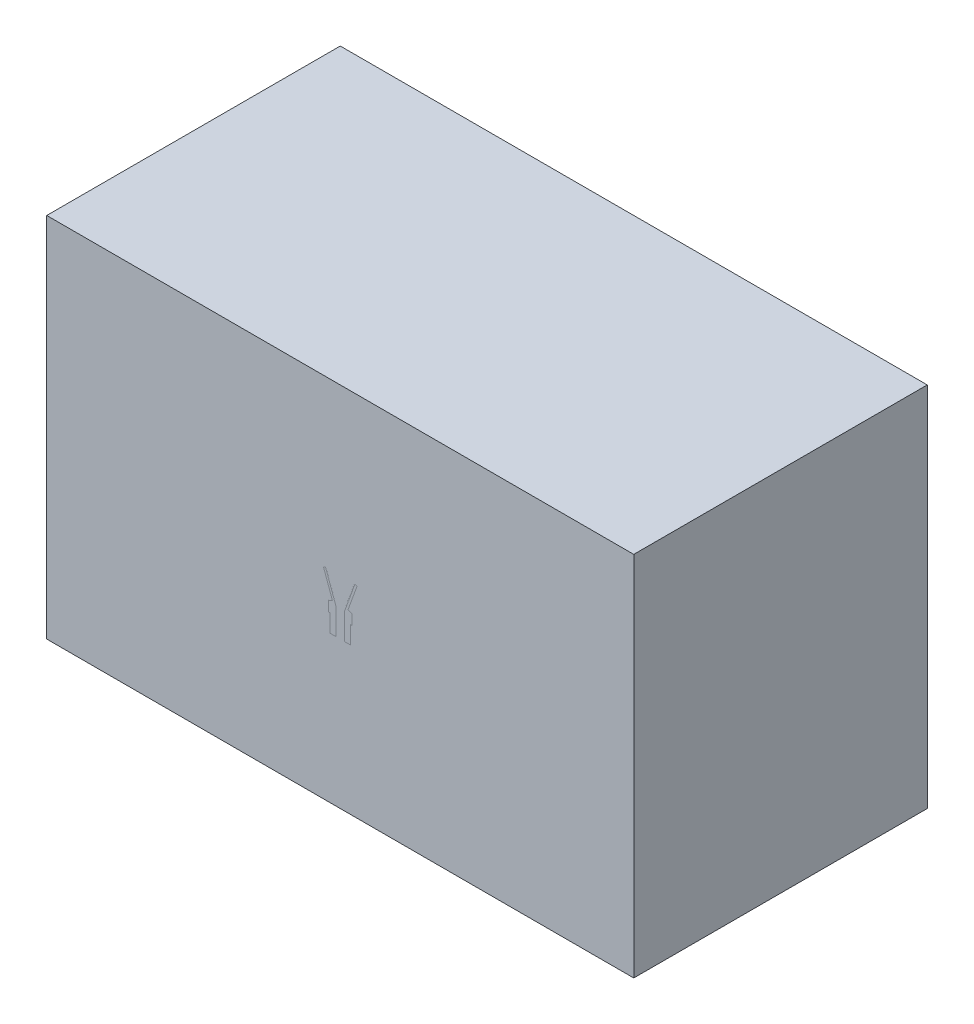
from build123d import *

# Parameters (mm, degrees)
SKETCH1_R           = 175
SKETCH1_R_2         = 75
BOSS_EXTRUDE1_DEPTH = 457
SKETCH3_W           = 10160
SKETCH3_H           = 6350
BOSS_EXTRUDE2_DEPTH = 5080
SKETCH4_W           = 13475.768327993
SKETCH4_H           = 8367.586519284
CUT_EXTRUDE1_DEPTH  = 8132.96778154


# Read off the part's stored shape, not the designer's step: Intersect1
with BuildPart() as part:
    # Sketch1 → Boss-Extrude1 (new body)
    with BuildSketch(Plane(origin=(0, 0, 0), x_dir=(1, 0, 0), z_dir=(0, 1, 0))):
        with Locations(Location((0, 0, 0), (0, 0, 270))):
            Circle(SKETCH1_R)
        with Locations(Location((0, 0, 0), (0, 0, 270))):
            Circle(SKETCH1_R_2, mode=Mode.SUBTRACT)
    extrude(amount=BOSS_EXTRUDE1_DEPTH)

    # Sketch2 → Revolve1 (revolve)
    with BuildSketch(Plane.XY, mode=Mode.PRIVATE) as revolve1_sk:
        Polygon((-175, 307), (-200.4, 307), (-200.4, 482.4), (-139.277313963, 504.646838356), (-135.674750747, 511.361444694), (-290.297671627, 936.184428342), (-254.495382775, 949.215395803), (-250.151726955, 937.281299519), (-239.483726955, 941.164133978), (-237.746264627, 936.390495464), (-248.414264627, 932.507661005), (-234.546998701, 894.407661005), (-223.878998701, 898.290495464), (-222.141536373, 893.516856951), (-232.809536373, 889.634022491), (-218.942270448, 851.534022491), (-208.274270448, 855.416856951), (-206.53680812, 850.643218437), (-217.20480812, 846.760383978), (-203.337542194, 808.660383978), (-192.669542194, 812.543218437), (-190.932079866, 807.769579923), (-201.600079866, 803.886745464), (-187.732813941, 765.786745464), (-177.064813941, 769.669579923), (-175.327351612, 764.89594141), (-185.995351612, 761.013106951), (-172.128085687, 722.913106951), (-161.460085687, 726.79594141), (-159.722623359, 722.022302896), (-170.390623359, 718.139468437), (-156.523357433, 680.039468437), (-145.855357433, 683.922302896), (-144.117895105, 679.148664383), (-154.785895105, 675.265829923), (-140.91862918, 637.165829923), (-130.25062918, 641.048664383), (-128.513166852, 636.275025869), (-139.181166852, 632.39219141), (-125.313900926, 594.29219141), (-114.645900926, 598.175025869), (-112.908438598, 593.401387355), (-123.576438598, 589.518552896), (-109.709172672, 551.418552896), (-99.041172672, 555.301387355), (-97.303710344, 550.527748842), (-107.668277546, 546.755354889), (-101.061934921, 528.604577704), (-75, 457), (-175, 457), align=None)
    revolve(revolve1_sk.sketch.rotate(Axis((0, 0, 0), (0, 1, 0)), 270), axis=Axis((0, 0, 0), (0, 1, 0)))


with BuildPart() as body_2:
    # Sketch3 → Boss-Extrude2 (new, symmetric)
    with BuildSketch(Plane(origin=(0, 0, 0), x_dir=(0, 0, -1), z_dir=(1, 0, 0))):
        with Locations((0, 635)):
            Rectangle(SKETCH3_W, SKETCH3_H)
    extrude(amount=BOSS_EXTRUDE2_DEPTH, both=True)

    # Intersect1 outline → Intersect1 (revolve, cut)
    with BuildSketch(Plane.XY):
        Polygon((107.668277546, 546.755354889), (75, 457), (75, 0), (175, 0), (175, 307), (200.4, 307), (200.4, 482.4), (139.277313963, 504.646838356), (135.674750747, 511.361444694), (290.297671627, 936.184428342), (254.495382775, 949.215395803), (250.151726955, 937.281299519), (239.483726955, 941.164133978), (237.746264627, 936.390495464), (248.414264627, 932.507661005), (234.546998701, 894.407661005), (223.878998701, 898.290495464), (222.141536373, 893.516856951), (232.809536373, 889.634022491), (218.942270448, 851.534022491), (208.274270448, 855.416856951), (206.53680812, 850.643218437), (217.20480812, 846.760383978), (203.337542194, 808.660383978), (192.669542194, 812.543218437), (190.932079866, 807.769579923), (201.600079866, 803.886745464), (187.732813941, 765.786745464), (177.064813941, 769.669579923), (175.327351612, 764.89594141), (185.995351612, 761.013106951), (172.128085687, 722.913106951), (161.460085687, 726.79594141), (159.722623359, 722.022302896), (170.390623359, 718.139468437), (156.523357433, 680.039468437), (145.855357433, 683.922302896), (144.117895105, 679.148664383), (154.785895105, 675.265829923), (140.91862918, 637.165829923), (130.25062918, 641.048664383), (128.513166852, 636.275025869), (139.181166852, 632.39219141), (125.313900926, 594.29219141), (114.645900926, 598.175025869), (112.908438598, 593.401387355), (123.576438598, 589.518552896), (109.709172672, 551.418552896), (99.041172672, 555.301387355), (97.303710344, 550.527748842), align=None)
    revolve(axis=Axis((0, 0, 0), (0, 1, 0)), mode=Mode.SUBTRACT)


with BuildPart() as cut_extrude1_tool:
    # Sketch4 → Cut-Extrude1 (new, through all)
    with BuildSketch(Plane.XY):
        with Locations((454.179344916, 464.014834855)):
            Rectangle(SKETCH4_W, SKETCH4_H)
    extrude(amount=CUT_EXTRUDE1_DEPTH)


with BuildPart() as part_1:
    add(part.part)

    # Cut-Extrude1: cut by cut_extrude1_tool
    add(cut_extrude1_tool.part, mode=Mode.SUBTRACT)


with BuildPart() as body_2_1:
    add(body_2.part)

    # Cut-Extrude1: cut by cut_extrude1_tool
    add(cut_extrude1_tool.part, mode=Mode.SUBTRACT)


solid = Compound([part_1.part, body_2_1.part])
